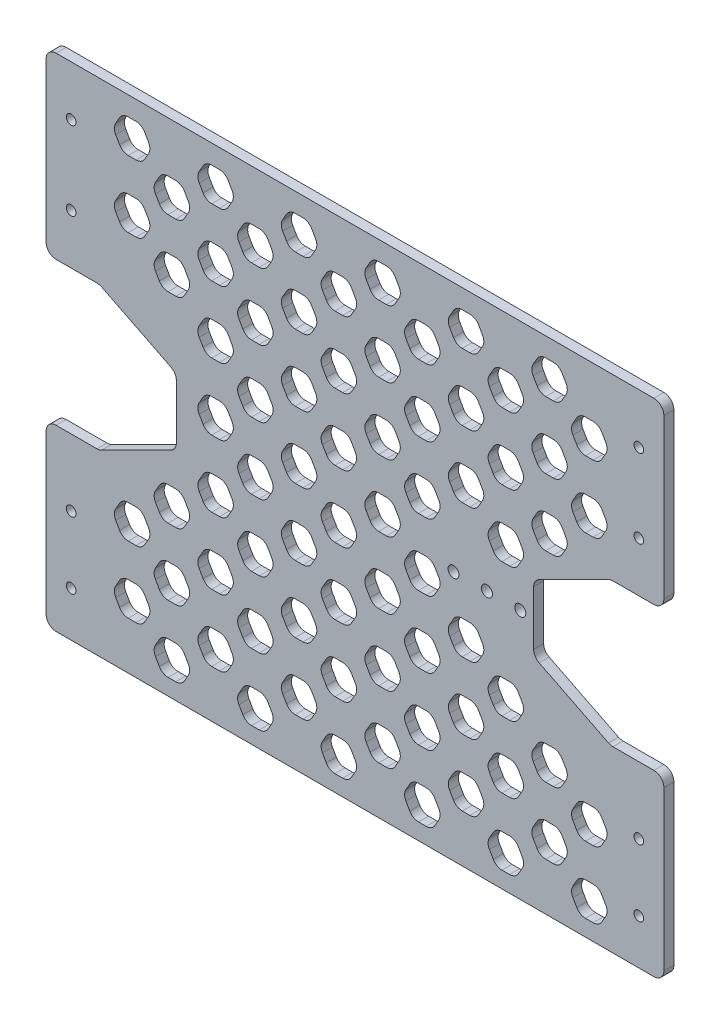
from build123d import *

# Parameters (mm, degrees)
EXTRUDE_1_DEPTH     = 3
FILLET_1_R          = 3
SKETCH_3_R          = 1.45
CUT_EXTRUDE_1_DEPTH = 10
SKETCH_4_R          = 1.65
CUT_EXTRUDE_2_DEPTH = 186.833258595
CUT_EXTRUDE_4_DEPTH = 186.833258595
FILLET_2_R          = 3


with BuildPart() as part:
    # 草图2 → 凸台-拉伸1 (new body)
    with BuildSketch(Plane.XY):
        Polygon((170, 75), (-15, 75), (-15, 21.5), (0.94427191, 21.5), (24, 9.972135955), (24, -9.972135955), (0.94427191, -21.5), (-15, -21.5), (-15, -75), (170, -75), (170, -21.5), (154.05572809, -21.5), (131, -9.972135955), (131, 9.972135955), (154.05572809, 21.5), (170, 21.5), align=None)
    extrude(amount=EXTRUDE_1_DEPTH)

    # 圆角1
    fillet_1_edges = [part.edges().sort_by_distance(p)[0] for p in [
        (131, 9.972135955, 1.5),
        (131, -9.972135955, 1.5),
        (154.05572809, -21.5, 1.5),
        (170, -21.5, 1.5),
        (170, -75, 1.5),
        (-15, -75, 1.5),
        (-15, -21.5, 1.5),
        (0.94427191, -21.5, 1.5),
        (24, -9.972135955, 1.5),
        (24, 9.972135955, 1.5),
        (0.94427191, 21.5, 1.5),
        (-15, 21.5, 1.5),
        (-15, 75, 1.5),
        (170, 75, 1.5),
        (170, 21.5, 1.5),
        (154.05572809, 21.5, 1.5),
    ]]
    fillet(fillet_1_edges, radius=FILLET_1_R)

    # 草图3 → 切除-拉伸1 (cut)
    with BuildSketch(Plane.XY.offset(3)):
        with Locations((-7.5, 60)):
            Circle(SKETCH_3_R)
        with Locations((162.5, 60)):
            Circle(SKETCH_3_R)
        with Locations((-7.5, -61.5)):
            Circle(SKETCH_3_R)
        with Locations((162.5, -61.5)):
            Circle(SKETCH_3_R)
        with Locations((-7.5, 36.5)):
            Circle(SKETCH_3_R)
        with Locations((162.5, 36.5)):
            Circle(SKETCH_3_R)
        with Locations((162.5, -41.5)):
            Circle(SKETCH_3_R)
        with Locations((-7.5, -41.5)):
            Circle(SKETCH_3_R)
    extrude(amount=-CUT_EXTRUDE_1_DEPTH, mode=Mode.SUBTRACT)

    # 草图4 → 切除-拉伸2 (cut, through all)
    with BuildSketch(Plane(origin=(0, 0, 0), x_dir=(-1, 0, 0), z_dir=(0, 0, -1))):
        with Locations((-127, 0)):
            Circle(SKETCH_4_R)
        with Locations((-107, 0)):
            Circle(SKETCH_4_R)
        with Locations((-117, 0)):
            Circle(SKETCH_4_R)
    extrude(amount=-CUT_EXTRUDE_2_DEPTH, mode=Mode.SUBTRACT)

    # 草图5 → 切除-拉伸4 (cut, through all)
    with BuildSketch(Plane.XY.offset(3)):
        Polygon((41.533979157, 64.264911716), (38.647227811, 69.264911716), (32.873725119, 69.264911716), (29.986973773, 64.264911716), (32.873725119, 59.264911716), (38.647227811, 59.264911716), align=None)
        Polygon((16.533979157, 64.264911716), (13.647227811, 69.264911716), (7.873725119, 69.264911716), (4.986973773, 64.264911716), (7.873725119, 59.264911716), (13.647227811, 59.264911716), align=None)
        Polygon((28.44061362, 54.887807553), (25.553862274, 59.887807553), (19.780359582, 59.887807553), (16.893608236, 54.887807553), (19.780359582, 49.887807553), (25.553862274, 49.887807553), align=None)
        Polygon((53.44061362, 54.887807553), (50.553862274, 59.887807553), (44.780359582, 59.887807553), (41.893608236, 54.887807553), (44.780359582, 49.887807553), (50.553862274, 49.887807553), align=None)
        Polygon((66.533979157, 64.264911716), (63.647227811, 69.264911716), (57.873725119, 69.264911716), (54.986973773, 64.264911716), (57.873725119, 59.264911716), (63.647227811, 59.264911716), align=None)
        Polygon((78.44061362, 54.887807553), (75.553862274, 59.887807553), (69.780359582, 59.887807553), (66.893608236, 54.887807553), (69.780359582, 49.887807553), (75.553862274, 49.887807553), align=None)
        Polygon((91.533979157, 64.264911716), (88.647227811, 69.264911716), (82.873725119, 69.264911716), (79.986973773, 64.264911716), (82.873725119, 59.264911716), (88.647227811, 59.264911716), align=None)
        Polygon((103.44061362, 54.887807553), (100.553862274, 59.887807553), (94.780359582, 59.887807553), (91.893608236, 54.887807553), (94.780359582, 49.887807553), (100.553862274, 49.887807553), align=None)
        Polygon((116.533979157, 64.264911716), (113.647227811, 69.264911716), (107.873725119, 69.264911716), (104.986973773, 64.264911716), (107.873725119, 59.264911716), (113.647227811, 59.264911716), align=None)
        Polygon((128.44061362, 54.887807553), (125.553862274, 59.887807553), (119.780359582, 59.887807553), (116.893608236, 54.887807553), (119.780359582, 49.887807553), (125.553862274, 49.887807553), align=None)
        Polygon((141.533979157, 64.264911716), (138.647227811, 69.264911716), (132.873725119, 69.264911716), (129.986973773, 64.264911716), (132.873725119, 59.264911716), (138.647227811, 59.264911716), align=None)
        Polygon((153.44061362, 54.887807553), (150.553862274, 59.887807553), (144.780359582, 59.887807553), (141.893608236, 54.887807553), (144.780359582, 49.887807553), (150.553862274, 49.887807553), align=None)
        Polygon((41.533979157, 44.264911716), (38.647227811, 49.264911716), (32.873725119, 49.264911716), (29.986973773, 44.264911716), (32.873725119, 39.264911716), (38.647227811, 39.264911716), align=None)
        Polygon((53.44061362, 34.887807553), (50.553862274, 39.887807553), (44.780359582, 39.887807553), (41.893608236, 34.887807553), (44.780359582, 29.887807553), (50.553862274, 29.887807553), align=None)
        Polygon((66.533979157, 44.264911716), (63.647227811, 49.264911716), (57.873725119, 49.264911716), (54.986973773, 44.264911716), (57.873725119, 39.264911716), (63.647227811, 39.264911716), align=None)
        Polygon((78.44061362, 34.887807553), (75.553862274, 39.887807553), (69.780359582, 39.887807553), (66.893608236, 34.887807553), (69.780359582, 29.887807553), (75.553862274, 29.887807553), align=None)
        Polygon((91.533979157, 44.264911716), (88.647227811, 49.264911716), (82.873725119, 49.264911716), (79.986973773, 44.264911716), (82.873725119, 39.264911716), (88.647227811, 39.264911716), align=None)
        Polygon((103.44061362, 34.887807553), (100.553862274, 39.887807553), (94.780359582, 39.887807553), (91.893608236, 34.887807553), (94.780359582, 29.887807553), (100.553862274, 29.887807553), align=None)
        Polygon((116.533979157, 44.264911716), (113.647227811, 49.264911716), (107.873725119, 49.264911716), (104.986973773, 44.264911716), (107.873725119, 39.264911716), (113.647227811, 39.264911716), align=None)
        Polygon((128.44061362, 34.887807553), (125.553862274, 39.887807553), (119.780359582, 39.887807553), (116.893608236, 34.887807553), (119.780359582, 29.887807553), (125.553862274, 29.887807553), align=None)
        Polygon((141.533979157, 44.264911716), (138.647227811, 49.264911716), (132.873725119, 49.264911716), (129.986973773, 44.264911716), (132.873725119, 39.264911716), (138.647227811, 39.264911716), align=None)
        Polygon((153.44061362, 34.887807553), (150.553862274, 39.887807553), (144.780359582, 39.887807553), (141.893608236, 34.887807553), (144.780359582, 29.887807553), (150.553862274, 29.887807553), align=None)
        Polygon((41.533979157, 24.264911716), (38.647227811, 29.264911716), (32.873725119, 29.264911716), (29.986973773, 24.264911716), (32.873725119, 19.264911716), (38.647227811, 19.264911716), align=None)
        Polygon((53.44061362, 14.887807553), (50.553862274, 19.887807553), (44.780359582, 19.887807553), (41.893608236, 14.887807553), (44.780359582, 9.887807553), (50.553862274, 9.887807553), align=None)
        Polygon((66.533979157, 24.264911716), (63.647227811, 29.264911716), (57.873725119, 29.264911716), (54.986973773, 24.264911716), (57.873725119, 19.264911716), (63.647227811, 19.264911716), align=None)
        Polygon((78.44061362, 14.887807553), (75.553862274, 19.887807553), (69.780359582, 19.887807553), (66.893608236, 14.887807553), (69.780359582, 9.887807553), (75.553862274, 9.887807553), align=None)
        Polygon((91.533979157, 24.264911716), (88.647227811, 29.264911716), (82.873725119, 29.264911716), (79.986973773, 24.264911716), (82.873725119, 19.264911716), (88.647227811, 19.264911716), align=None)
        Polygon((103.44061362, 14.887807553), (100.553862274, 19.887807553), (94.780359582, 19.887807553), (91.893608236, 14.887807553), (94.780359582, 9.887807553), (100.553862274, 9.887807553), align=None)
        Polygon((116.533979157, 24.264911716), (113.647227811, 29.264911716), (107.873725119, 29.264911716), (104.986973773, 24.264911716), (107.873725119, 19.264911716), (113.647227811, 19.264911716), align=None)
        Polygon((128.44061362, 14.887807553), (125.553862274, 19.887807553), (119.780359582, 19.887807553), (116.893608236, 14.887807553), (119.780359582, 9.887807553), (125.553862274, 9.887807553), align=None)
        Polygon((141.533979157, 24.264911716), (138.647227811, 29.264911716), (132.873725119, 29.264911716), (129.986973773, 24.264911716), (132.873725119, 19.264911716), (138.647227811, 19.264911716), align=None)
        Polygon((41.533979157, 4.264911716), (38.647227811, 9.264911716), (32.873725119, 9.264911716), (29.986973773, 4.264911716), (32.873725119, -0.735088284), (38.647227811, -0.735088284), align=None)
        Polygon((53.44061362, -5.112192447), (50.553862274, -0.112192447), (44.780359582, -0.112192447), (41.893608236, -5.112192447), (44.780359582, -10.112192447), (50.553862274, -10.112192447), align=None)
        Polygon((66.533979157, 4.264911716), (63.647227811, 9.264911716), (57.873725119, 9.264911716), (54.986973773, 4.264911716), (57.873725119, -0.735088284), (63.647227811, -0.735088284), align=None)
        Polygon((78.44061362, -5.112192447), (75.553862274, -0.112192447), (69.780359582, -0.112192447), (66.893608236, -5.112192447), (69.780359582, -10.112192447), (75.553862274, -10.112192447), align=None)
        Polygon((91.533979157, 4.264911716), (88.647227811, 9.264911716), (82.873725119, 9.264911716), (79.986973773, 4.264911716), (82.873725119, -0.735088284), (88.647227811, -0.735088284), align=None)
        Polygon((103.44061362, -5.112192447), (100.553862274, -0.112192447), (94.780359582, -0.112192447), (91.893608236, -5.112192447), (94.780359582, -10.112192447), (100.553862274, -10.112192447), align=None)
        Polygon((41.533979157, -15.735088284), (38.647227811, -10.735088284), (32.873725119, -10.735088284), (29.986973773, -15.735088284), (32.873725119, -20.735088284), (38.647227811, -20.735088284), align=None)
        Polygon((53.44061362, -25.112192447), (50.553862274, -20.112192447), (44.780359582, -20.112192447), (41.893608236, -25.112192447), (44.780359582, -30.112192447), (50.553862274, -30.112192447), align=None)
        Polygon((66.533979157, -15.735088284), (63.647227811, -10.735088284), (57.873725119, -10.735088284), (54.986973773, -15.735088284), (57.873725119, -20.735088284), (63.647227811, -20.735088284), align=None)
        Polygon((78.44061362, -25.112192447), (75.553862274, -20.112192447), (69.780359582, -20.112192447), (66.893608236, -25.112192447), (69.780359582, -30.112192447), (75.553862274, -30.112192447), align=None)
        Polygon((91.533979157, -15.735088284), (88.647227811, -10.735088284), (82.873725119, -10.735088284), (79.986973773, -15.735088284), (82.873725119, -20.735088284), (88.647227811, -20.735088284), align=None)
        Polygon((103.44061362, -25.112192447), (100.553862274, -20.112192447), (94.780359582, -20.112192447), (91.893608236, -25.112192447), (94.780359582, -30.112192447), (100.553862274, -30.112192447), align=None)
        Polygon((116.533979157, -15.735088284), (113.647227811, -10.735088284), (107.873725119, -10.735088284), (104.986973773, -15.735088284), (107.873725119, -20.735088284), (113.647227811, -20.735088284), align=None)
        Polygon((128.44061362, -25.112192447), (125.553862274, -20.112192447), (119.780359582, -20.112192447), (116.893608236, -25.112192447), (119.780359582, -30.112192447), (125.553862274, -30.112192447), align=None)
        Polygon((41.533979157, -35.735088284), (38.647227811, -30.735088284), (32.873725119, -30.735088284), (29.986973773, -35.735088284), (32.873725119, -40.735088284), (38.647227811, -40.735088284), align=None)
        Polygon((53.44061362, -45.112192447), (50.553862274, -40.112192447), (44.780359582, -40.112192447), (41.893608236, -45.112192447), (44.780359582, -50.112192447), (50.553862274, -50.112192447), align=None)
        Polygon((66.533979157, -35.735088284), (63.647227811, -30.735088284), (57.873725119, -30.735088284), (54.986973773, -35.735088284), (57.873725119, -40.735088284), (63.647227811, -40.735088284), align=None)
        Polygon((78.44061362, -45.112192447), (75.553862274, -40.112192447), (69.780359582, -40.112192447), (66.893608236, -45.112192447), (69.780359582, -50.112192447), (75.553862274, -50.112192447), align=None)
        Polygon((91.533979157, -35.735088284), (88.647227811, -30.735088284), (82.873725119, -30.735088284), (79.986973773, -35.735088284), (82.873725119, -40.735088284), (88.647227811, -40.735088284), align=None)
        Polygon((103.44061362, -45.112192447), (100.553862274, -40.112192447), (94.780359582, -40.112192447), (91.893608236, -45.112192447), (94.780359582, -50.112192447), (100.553862274, -50.112192447), align=None)
        Polygon((116.533979157, -35.735088284), (113.647227811, -30.735088284), (107.873725119, -30.735088284), (104.986973773, -35.735088284), (107.873725119, -40.735088284), (113.647227811, -40.735088284), align=None)
        Polygon((128.44061362, -45.112192447), (125.553862274, -40.112192447), (119.780359582, -40.112192447), (116.893608236, -45.112192447), (119.780359582, -50.112192447), (125.553862274, -50.112192447), align=None)
        Polygon((141.533979157, -35.735088284), (138.647227811, -30.735088284), (132.873725119, -30.735088284), (129.986973773, -35.735088284), (132.873725119, -40.735088284), (138.647227811, -40.735088284), align=None)
        Polygon((153.44061362, -45.112192447), (150.553862274, -40.112192447), (144.780359582, -40.112192447), (141.893608236, -45.112192447), (144.780359582, -50.112192447), (150.553862274, -50.112192447), align=None)
        Polygon((41.533979157, -55.735088284), (38.647227811, -50.735088284), (32.873725119, -50.735088284), (29.986973773, -55.735088284), (32.873725119, -60.735088284), (38.647227811, -60.735088284), align=None)
        Polygon((53.44061362, -65.112192447), (50.553862274, -60.112192447), (44.780359582, -60.112192447), (41.893608236, -65.112192447), (44.780359582, -70.112192447), (50.553862274, -70.112192447), align=None)
        Polygon((66.533979157, -55.735088284), (63.647227811, -50.735088284), (57.873725119, -50.735088284), (54.986973773, -55.735088284), (57.873725119, -60.735088284), (63.647227811, -60.735088284), align=None)
        Polygon((78.44061362, -65.112192447), (75.553862274, -60.112192447), (69.780359582, -60.112192447), (66.893608236, -65.112192447), (69.780359582, -70.112192447), (75.553862274, -70.112192447), align=None)
        Polygon((91.533979157, -55.735088284), (88.647227811, -50.735088284), (82.873725119, -50.735088284), (79.986973773, -55.735088284), (82.873725119, -60.735088284), (88.647227811, -60.735088284), align=None)
        Polygon((103.44061362, -65.112192447), (100.553862274, -60.112192447), (94.780359582, -60.112192447), (91.893608236, -65.112192447), (94.780359582, -70.112192447), (100.553862274, -70.112192447), align=None)
        Polygon((116.533979157, -55.735088284), (113.647227811, -50.735088284), (107.873725119, -50.735088284), (104.986973773, -55.735088284), (107.873725119, -60.735088284), (113.647227811, -60.735088284), align=None)
        Polygon((128.44061362, -65.112192447), (125.553862274, -60.112192447), (119.780359582, -60.112192447), (116.893608236, -65.112192447), (119.780359582, -70.112192447), (125.553862274, -70.112192447), align=None)
        Polygon((141.533979157, -55.735088284), (138.647227811, -50.735088284), (132.873725119, -50.735088284), (129.986973773, -55.735088284), (132.873725119, -60.735088284), (138.647227811, -60.735088284), align=None)
        Polygon((153.44061362, -65.112192447), (150.553862274, -60.112192447), (144.780359582, -60.112192447), (141.893608236, -65.112192447), (144.780359582, -70.112192447), (150.553862274, -70.112192447), align=None)
        Polygon((16.533979157, 44.264911716), (13.647227811, 49.264911716), (7.873725119, 49.264911716), (4.986973773, 44.264911716), (7.873725119, 39.264911716), (13.647227811, 39.264911716), align=None)
        Polygon((28.44061362, 34.887807553), (25.553862274, 39.887807553), (19.780359582, 39.887807553), (16.893608236, 34.887807553), (19.780359582, 29.887807553), (25.553862274, 29.887807553), align=None)
        Polygon((28.44061362, -25.112192447), (25.553862274, -20.112192447), (19.780359582, -20.112192447), (16.893608236, -25.112192447), (19.780359582, -30.112192447), (25.553862274, -30.112192447), align=None)
        Polygon((16.533979157, -35.735088284), (13.647227811, -30.735088284), (7.873725119, -30.735088284), (4.986973773, -35.735088284), (7.873725119, -40.735088284), (13.647227811, -40.735088284), align=None)
        Polygon((28.44061362, -45.112192447), (25.553862274, -40.112192447), (19.780359582, -40.112192447), (16.893608236, -45.112192447), (19.780359582, -50.112192447), (25.553862274, -50.112192447), align=None)
        Polygon((16.533979157, -55.735088284), (13.647227811, -50.735088284), (7.873725119, -50.735088284), (4.986973773, -55.735088284), (7.873725119, -60.735088284), (13.647227811, -60.735088284), align=None)
        Polygon((28.44061362, -65.112192447), (25.553862274, -60.112192447), (19.780359582, -60.112192447), (16.893608236, -65.112192447), (19.780359582, -70.112192447), (25.553862274, -70.112192447), align=None)
    extrude(amount=-CUT_EXTRUDE_4_DEPTH, mode=Mode.SUBTRACT)

    # 圆角2
    fillet_2_edges = [part.edges().sort_by_distance(p)[0] for p in [
        (13.647227811, -50.735088284, 1.5),
        (16.533979157, -55.735088284, 1.5),
        (7.873725119, -50.735088284, 1.5),
        (4.986973773, -55.735088284, 1.5),
        (7.873725119, -60.735088284, 1.5),
        (13.647227811, -60.735088284, 1.5),
        (25.553862274, -60.112192447, 1.5),
        (28.44061362, -65.112192447, 1.5),
        (19.780359582, -60.112192447, 1.5),
        (16.893608236, -65.112192447, 1.5),
        (19.780359582, -70.112192447, 1.5),
        (25.553862274, -70.112192447, 1.5),
        (13.647227811, -30.735088284, 1.5),
        (16.533979157, -35.735088284, 1.5),
        (7.873725119, -30.735088284, 1.5),
        (4.986973773, -35.735088284, 1.5),
        (7.873725119, -40.735088284, 1.5),
        (13.647227811, -40.735088284, 1.5),
        (25.553862274, -40.112192447, 1.5),
        (28.44061362, -45.112192447, 1.5),
        (19.780359582, -40.112192447, 1.5),
        (16.893608236, -45.112192447, 1.5),
        (19.780359582, -50.112192447, 1.5),
        (25.553862274, -50.112192447, 1.5),
        (50.553862274, -60.112192447, 1.5),
        (53.44061362, -65.112192447, 1.5),
        (44.780359582, -60.112192447, 1.5),
        (41.893608236, -65.112192447, 1.5),
        (44.780359582, -70.112192447, 1.5),
        (50.553862274, -70.112192447, 1.5),
        (38.647227811, -50.735088284, 1.5),
        (41.533979157, -55.735088284, 1.5),
        (32.873725119, -50.735088284, 1.5),
        (29.986973773, -55.735088284, 1.5),
        (32.873725119, -60.735088284, 1.5),
        (38.647227811, -60.735088284, 1.5),
        (75.553862274, -60.112192447, 1.5),
        (78.44061362, -65.112192447, 1.5),
        (69.780359582, -60.112192447, 1.5),
        (66.893608236, -65.112192447, 1.5),
        (69.780359582, -70.112192447, 1.5),
        (75.553862274, -70.112192447, 1.5),
        (63.647227811, -50.735088284, 1.5),
        (66.533979157, -55.735088284, 1.5),
        (57.873725119, -50.735088284, 1.5),
        (54.986973773, -55.735088284, 1.5),
        (57.873725119, -60.735088284, 1.5),
        (63.647227811, -60.735088284, 1.5),
        (50.553862274, -40.112192447, 1.5),
        (53.44061362, -45.112192447, 1.5),
        (44.780359582, -40.112192447, 1.5),
        (41.893608236, -45.112192447, 1.5),
        (44.780359582, -50.112192447, 1.5),
        (50.553862274, -50.112192447, 1.5),
        (38.647227811, -30.735088284, 1.5),
        (41.533979157, -35.735088284, 1.5),
        (32.873725119, -30.735088284, 1.5),
        (29.986973773, -35.735088284, 1.5),
        (32.873725119, -40.735088284, 1.5),
        (38.647227811, -40.735088284, 1.5),
        (75.553862274, -40.112192447, 1.5),
        (78.44061362, -45.112192447, 1.5),
        (69.780359582, -40.112192447, 1.5),
        (66.893608236, -45.112192447, 1.5),
        (69.780359582, -50.112192447, 1.5),
        (75.553862274, -50.112192447, 1.5),
        (63.647227811, -30.735088284, 1.5),
        (66.533979157, -35.735088284, 1.5),
        (57.873725119, -30.735088284, 1.5),
        (54.986973773, -35.735088284, 1.5),
        (57.873725119, -40.735088284, 1.5),
        (63.647227811, -40.735088284, 1.5),
        (25.553862274, -20.112192447, 1.5),
        (28.44061362, -25.112192447, 1.5),
        (19.780359582, -20.112192447, 1.5),
        (16.893608236, -25.112192447, 1.5),
        (19.780359582, -30.112192447, 1.5),
        (25.553862274, -30.112192447, 1.5),
        (50.553862274, -20.112192447, 1.5),
        (53.44061362, -25.112192447, 1.5),
        (44.780359582, -20.112192447, 1.5),
        (41.893608236, -25.112192447, 1.5),
        (44.780359582, -30.112192447, 1.5),
        (50.553862274, -30.112192447, 1.5),
        (75.553862274, -20.112192447, 1.5),
        (78.44061362, -25.112192447, 1.5),
        (69.780359582, -20.112192447, 1.5),
        (66.893608236, -25.112192447, 1.5),
        (69.780359582, -30.112192447, 1.5),
        (75.553862274, -30.112192447, 1.5),
        (38.647227811, -10.735088284, 1.5),
        (41.533979157, -15.735088284, 1.5),
        (32.873725119, -10.735088284, 1.5),
        (29.986973773, -15.735088284, 1.5),
        (32.873725119, -20.735088284, 1.5),
        (38.647227811, -20.735088284, 1.5),
        (50.553862274, -0.112192447, 1.5),
        (53.44061362, -5.112192447, 1.5),
        (44.780359582, -0.112192447, 1.5),
        (41.893608236, -5.112192447, 1.5),
        (44.780359582, -10.112192447, 1.5),
        (50.553862274, -10.112192447, 1.5),
        (63.647227811, -10.735088284, 1.5),
        (66.533979157, -15.735088284, 1.5),
        (57.873725119, -10.735088284, 1.5),
        (54.986973773, -15.735088284, 1.5),
        (57.873725119, -20.735088284, 1.5),
        (63.647227811, -20.735088284, 1.5),
        (75.553862274, -0.112192447, 1.5),
        (78.44061362, -5.112192447, 1.5),
        (69.780359582, -0.112192447, 1.5),
        (66.893608236, -5.112192447, 1.5),
        (69.780359582, -10.112192447, 1.5),
        (75.553862274, -10.112192447, 1.5),
        (100.553862274, -60.112192447, 1.5),
        (103.44061362, -65.112192447, 1.5),
        (94.780359582, -60.112192447, 1.5),
        (91.893608236, -65.112192447, 1.5),
        (94.780359582, -70.112192447, 1.5),
        (100.553862274, -70.112192447, 1.5),
        (88.647227811, -50.735088284, 1.5),
        (91.533979157, -55.735088284, 1.5),
        (82.873725119, -50.735088284, 1.5),
        (79.986973773, -55.735088284, 1.5),
        (82.873725119, -60.735088284, 1.5),
        (88.647227811, -60.735088284, 1.5),
        (113.647227811, -50.735088284, 1.5),
        (116.533979157, -55.735088284, 1.5),
        (107.873725119, -50.735088284, 1.5),
        (104.986973773, -55.735088284, 1.5),
        (107.873725119, -60.735088284, 1.5),
        (113.647227811, -60.735088284, 1.5),
        (100.553862274, -40.112192447, 1.5),
        (103.44061362, -45.112192447, 1.5),
        (94.780359582, -40.112192447, 1.5),
        (91.893608236, -45.112192447, 1.5),
        (94.780359582, -50.112192447, 1.5),
        (100.553862274, -50.112192447, 1.5),
        (88.647227811, -30.735088284, 1.5),
        (91.533979157, -35.735088284, 1.5),
        (82.873725119, -30.735088284, 1.5),
        (79.986973773, -35.735088284, 1.5),
        (82.873725119, -40.735088284, 1.5),
        (88.647227811, -40.735088284, 1.5),
        (113.647227811, -30.735088284, 1.5),
        (116.533979157, -35.735088284, 1.5),
        (107.873725119, -30.735088284, 1.5),
        (104.986973773, -35.735088284, 1.5),
        (107.873725119, -40.735088284, 1.5),
        (113.647227811, -40.735088284, 1.5),
        (125.553862274, -60.112192447, 1.5),
        (128.44061362, -65.112192447, 1.5),
        (119.780359582, -60.112192447, 1.5),
        (116.893608236, -65.112192447, 1.5),
        (119.780359582, -70.112192447, 1.5),
        (125.553862274, -70.112192447, 1.5),
        (138.647227811, -50.735088284, 1.5),
        (141.533979157, -55.735088284, 1.5),
        (132.873725119, -50.735088284, 1.5),
        (129.986973773, -55.735088284, 1.5),
        (132.873725119, -60.735088284, 1.5),
        (138.647227811, -60.735088284, 1.5),
        (150.553862274, -60.112192447, 1.5),
        (153.44061362, -65.112192447, 1.5),
        (144.780359582, -60.112192447, 1.5),
        (141.893608236, -65.112192447, 1.5),
        (144.780359582, -70.112192447, 1.5),
        (150.553862274, -70.112192447, 1.5),
        (125.553862274, -40.112192447, 1.5),
        (128.44061362, -45.112192447, 1.5),
        (119.780359582, -40.112192447, 1.5),
        (116.893608236, -45.112192447, 1.5),
        (119.780359582, -50.112192447, 1.5),
        (125.553862274, -50.112192447, 1.5),
        (138.647227811, -30.735088284, 1.5),
        (141.533979157, -35.735088284, 1.5),
        (132.873725119, -30.735088284, 1.5),
        (129.986973773, -35.735088284, 1.5),
        (132.873725119, -40.735088284, 1.5),
        (138.647227811, -40.735088284, 1.5),
        (150.553862274, -40.112192447, 1.5),
        (153.44061362, -45.112192447, 1.5),
        (144.780359582, -40.112192447, 1.5),
        (141.893608236, -45.112192447, 1.5),
        (144.780359582, -50.112192447, 1.5),
        (150.553862274, -50.112192447, 1.5),
        (100.553862274, -20.112192447, 1.5),
        (103.44061362, -25.112192447, 1.5),
        (94.780359582, -20.112192447, 1.5),
        (91.893608236, -25.112192447, 1.5),
        (94.780359582, -30.112192447, 1.5),
        (100.553862274, -30.112192447, 1.5),
        (88.647227811, -10.735088284, 1.5),
        (91.533979157, -15.735088284, 1.5),
        (82.873725119, -10.735088284, 1.5),
        (79.986973773, -15.735088284, 1.5),
        (82.873725119, -20.735088284, 1.5),
        (88.647227811, -20.735088284, 1.5),
        (100.553862274, -0.112192447, 1.5),
        (103.44061362, -5.112192447, 1.5),
        (94.780359582, -0.112192447, 1.5),
        (91.893608236, -5.112192447, 1.5),
        (94.780359582, -10.112192447, 1.5),
        (100.553862274, -10.112192447, 1.5),
        (113.647227811, -10.735088284, 1.5),
        (116.533979157, -15.735088284, 1.5),
        (107.873725119, -10.735088284, 1.5),
        (104.986973773, -15.735088284, 1.5),
        (107.873725119, -20.735088284, 1.5),
        (113.647227811, -20.735088284, 1.5),
        (125.553862274, -20.112192447, 1.5),
        (128.44061362, -25.112192447, 1.5),
        (119.780359582, -20.112192447, 1.5),
        (116.893608236, -25.112192447, 1.5),
        (119.780359582, -30.112192447, 1.5),
        (125.553862274, -30.112192447, 1.5),
        (38.647227811, 9.264911716, 1.5),
        (41.533979157, 4.264911716, 1.5),
        (32.873725119, 9.264911716, 1.5),
        (29.986973773, 4.264911716, 1.5),
        (32.873725119, -0.735088284, 1.5),
        (38.647227811, -0.735088284, 1.5),
        (50.553862274, 19.887807553, 1.5),
        (53.44061362, 14.887807553, 1.5),
        (44.780359582, 19.887807553, 1.5),
        (41.893608236, 14.887807553, 1.5),
        (44.780359582, 9.887807553, 1.5),
        (50.553862274, 9.887807553, 1.5),
        (63.647227811, 9.264911716, 1.5),
        (66.533979157, 4.264911716, 1.5),
        (57.873725119, 9.264911716, 1.5),
        (54.986973773, 4.264911716, 1.5),
        (57.873725119, -0.735088284, 1.5),
        (63.647227811, -0.735088284, 1.5),
        (75.553862274, 19.887807553, 1.5),
        (78.44061362, 14.887807553, 1.5),
        (69.780359582, 19.887807553, 1.5),
        (66.893608236, 14.887807553, 1.5),
        (69.780359582, 9.887807553, 1.5),
        (75.553862274, 9.887807553, 1.5),
        (38.647227811, 29.264911716, 1.5),
        (41.533979157, 24.264911716, 1.5),
        (32.873725119, 29.264911716, 1.5),
        (29.986973773, 24.264911716, 1.5),
        (32.873725119, 19.264911716, 1.5),
        (38.647227811, 19.264911716, 1.5),
        (63.647227811, 29.264911716, 1.5),
        (66.533979157, 24.264911716, 1.5),
        (57.873725119, 29.264911716, 1.5),
        (54.986973773, 24.264911716, 1.5),
        (57.873725119, 19.264911716, 1.5),
        (63.647227811, 19.264911716, 1.5),
        (13.647227811, 49.264911716, 1.5),
        (16.533979157, 44.264911716, 1.5),
        (7.873725119, 49.264911716, 1.5),
        (4.986973773, 44.264911716, 1.5),
        (7.873725119, 39.264911716, 1.5),
        (13.647227811, 39.264911716, 1.5),
        (25.553862274, 39.887807553, 1.5),
        (28.44061362, 34.887807553, 1.5),
        (19.780359582, 39.887807553, 1.5),
        (16.893608236, 34.887807553, 1.5),
        (19.780359582, 29.887807553, 1.5),
        (25.553862274, 29.887807553, 1.5),
        (13.647227811, 69.264911716, 1.5),
        (16.533979157, 64.264911716, 1.5),
        (7.873725119, 69.264911716, 1.5),
        (4.986973773, 64.264911716, 1.5),
        (7.873725119, 59.264911716, 1.5),
        (13.647227811, 59.264911716, 1.5),
        (25.553862274, 59.887807553, 1.5),
        (28.44061362, 54.887807553, 1.5),
        (19.780359582, 59.887807553, 1.5),
        (16.893608236, 54.887807553, 1.5),
        (19.780359582, 49.887807553, 1.5),
        (25.553862274, 49.887807553, 1.5),
        (50.553862274, 39.887807553, 1.5),
        (53.44061362, 34.887807553, 1.5),
        (44.780359582, 39.887807553, 1.5),
        (41.893608236, 34.887807553, 1.5),
        (44.780359582, 29.887807553, 1.5),
        (50.553862274, 29.887807553, 1.5),
        (38.647227811, 49.264911716, 1.5),
        (41.533979157, 44.264911716, 1.5),
        (32.873725119, 49.264911716, 1.5),
        (29.986973773, 44.264911716, 1.5),
        (32.873725119, 39.264911716, 1.5),
        (38.647227811, 39.264911716, 1.5),
        (75.553862274, 39.887807553, 1.5),
        (78.44061362, 34.887807553, 1.5),
        (69.780359582, 39.887807553, 1.5),
        (66.893608236, 34.887807553, 1.5),
        (69.780359582, 29.887807553, 1.5),
        (75.553862274, 29.887807553, 1.5),
        (63.647227811, 49.264911716, 1.5),
        (66.533979157, 44.264911716, 1.5),
        (57.873725119, 49.264911716, 1.5),
        (54.986973773, 44.264911716, 1.5),
        (57.873725119, 39.264911716, 1.5),
        (63.647227811, 39.264911716, 1.5),
        (50.553862274, 59.887807553, 1.5),
        (53.44061362, 54.887807553, 1.5),
        (44.780359582, 59.887807553, 1.5),
        (41.893608236, 54.887807553, 1.5),
        (44.780359582, 49.887807553, 1.5),
        (50.553862274, 49.887807553, 1.5),
        (38.647227811, 69.264911716, 1.5),
        (41.533979157, 64.264911716, 1.5),
        (32.873725119, 69.264911716, 1.5),
        (29.986973773, 64.264911716, 1.5),
        (32.873725119, 59.264911716, 1.5),
        (38.647227811, 59.264911716, 1.5),
        (75.553862274, 59.887807553, 1.5),
        (78.44061362, 54.887807553, 1.5),
        (69.780359582, 59.887807553, 1.5),
        (66.893608236, 54.887807553, 1.5),
        (69.780359582, 49.887807553, 1.5),
        (75.553862274, 49.887807553, 1.5),
        (63.647227811, 69.264911716, 1.5),
        (66.533979157, 64.264911716, 1.5),
        (57.873725119, 69.264911716, 1.5),
        (54.986973773, 64.264911716, 1.5),
        (57.873725119, 59.264911716, 1.5),
        (63.647227811, 59.264911716, 1.5),
        (88.647227811, 9.264911716, 1.5),
        (91.533979157, 4.264911716, 1.5),
        (82.873725119, 9.264911716, 1.5),
        (79.986973773, 4.264911716, 1.5),
        (82.873725119, -0.735088284, 1.5),
        (88.647227811, -0.735088284, 1.5),
        (100.553862274, 19.887807553, 1.5),
        (103.44061362, 14.887807553, 1.5),
        (94.780359582, 19.887807553, 1.5),
        (91.893608236, 14.887807553, 1.5),
        (94.780359582, 9.887807553, 1.5),
        (100.553862274, 9.887807553, 1.5),
        (88.647227811, 29.264911716, 1.5),
        (91.533979157, 24.264911716, 1.5),
        (82.873725119, 29.264911716, 1.5),
        (79.986973773, 24.264911716, 1.5),
        (82.873725119, 19.264911716, 1.5),
        (88.647227811, 19.264911716, 1.5),
        (113.647227811, 29.264911716, 1.5),
        (116.533979157, 24.264911716, 1.5),
        (107.873725119, 29.264911716, 1.5),
        (104.986973773, 24.264911716, 1.5),
        (107.873725119, 19.264911716, 1.5),
        (113.647227811, 19.264911716, 1.5),
        (125.553862274, 19.887807553, 1.5),
        (128.44061362, 14.887807553, 1.5),
        (119.780359582, 19.887807553, 1.5),
        (116.893608236, 14.887807553, 1.5),
        (119.780359582, 9.887807553, 1.5),
        (125.553862274, 9.887807553, 1.5),
        (138.647227811, 29.264911716, 1.5),
        (141.533979157, 24.264911716, 1.5),
        (132.873725119, 29.264911716, 1.5),
        (129.986973773, 24.264911716, 1.5),
        (132.873725119, 19.264911716, 1.5),
        (138.647227811, 19.264911716, 1.5),
        (100.553862274, 39.887807553, 1.5),
        (103.44061362, 34.887807553, 1.5),
        (94.780359582, 39.887807553, 1.5),
        (91.893608236, 34.887807553, 1.5),
        (94.780359582, 29.887807553, 1.5),
        (100.553862274, 29.887807553, 1.5),
        (88.647227811, 49.264911716, 1.5),
        (91.533979157, 44.264911716, 1.5),
        (82.873725119, 49.264911716, 1.5),
        (79.986973773, 44.264911716, 1.5),
        (82.873725119, 39.264911716, 1.5),
        (88.647227811, 39.264911716, 1.5),
        (113.647227811, 49.264911716, 1.5),
        (116.533979157, 44.264911716, 1.5),
        (107.873725119, 49.264911716, 1.5),
        (104.986973773, 44.264911716, 1.5),
        (107.873725119, 39.264911716, 1.5),
        (113.647227811, 39.264911716, 1.5),
        (100.553862274, 59.887807553, 1.5),
        (103.44061362, 54.887807553, 1.5),
        (94.780359582, 59.887807553, 1.5),
        (91.893608236, 54.887807553, 1.5),
        (94.780359582, 49.887807553, 1.5),
        (100.553862274, 49.887807553, 1.5),
        (88.647227811, 69.264911716, 1.5),
        (91.533979157, 64.264911716, 1.5),
        (82.873725119, 69.264911716, 1.5),
        (79.986973773, 64.264911716, 1.5),
        (82.873725119, 59.264911716, 1.5),
        (88.647227811, 59.264911716, 1.5),
        (113.647227811, 69.264911716, 1.5),
        (116.533979157, 64.264911716, 1.5),
        (107.873725119, 69.264911716, 1.5),
        (104.986973773, 64.264911716, 1.5),
        (107.873725119, 59.264911716, 1.5),
        (113.647227811, 59.264911716, 1.5),
        (125.553862274, 39.887807553, 1.5),
        (128.44061362, 34.887807553, 1.5),
        (119.780359582, 39.887807553, 1.5),
        (116.893608236, 34.887807553, 1.5),
        (119.780359582, 29.887807553, 1.5),
        (125.553862274, 29.887807553, 1.5),
        (138.647227811, 49.264911716, 1.5),
        (141.533979157, 44.264911716, 1.5),
        (132.873725119, 49.264911716, 1.5),
        (129.986973773, 44.264911716, 1.5),
        (132.873725119, 39.264911716, 1.5),
        (138.647227811, 39.264911716, 1.5),
        (150.553862274, 39.887807553, 1.5),
        (153.44061362, 34.887807553, 1.5),
        (144.780359582, 39.887807553, 1.5),
        (141.893608236, 34.887807553, 1.5),
        (144.780359582, 29.887807553, 1.5),
        (150.553862274, 29.887807553, 1.5),
        (125.553862274, 59.887807553, 1.5),
        (128.44061362, 54.887807553, 1.5),
        (119.780359582, 59.887807553, 1.5),
        (116.893608236, 54.887807553, 1.5),
        (119.780359582, 49.887807553, 1.5),
        (125.553862274, 49.887807553, 1.5),
        (138.647227811, 69.264911716, 1.5),
        (141.533979157, 64.264911716, 1.5),
        (132.873725119, 69.264911716, 1.5),
        (129.986973773, 64.264911716, 1.5),
        (132.873725119, 59.264911716, 1.5),
        (138.647227811, 59.264911716, 1.5),
        (150.553862274, 59.887807553, 1.5),
        (153.44061362, 54.887807553, 1.5),
        (144.780359582, 59.887807553, 1.5),
        (141.893608236, 54.887807553, 1.5),
        (144.780359582, 49.887807553, 1.5),
        (150.553862274, 49.887807553, 1.5),
    ]]
    fillet(fillet_2_edges, radius=FILLET_2_R)


solid = part.part
